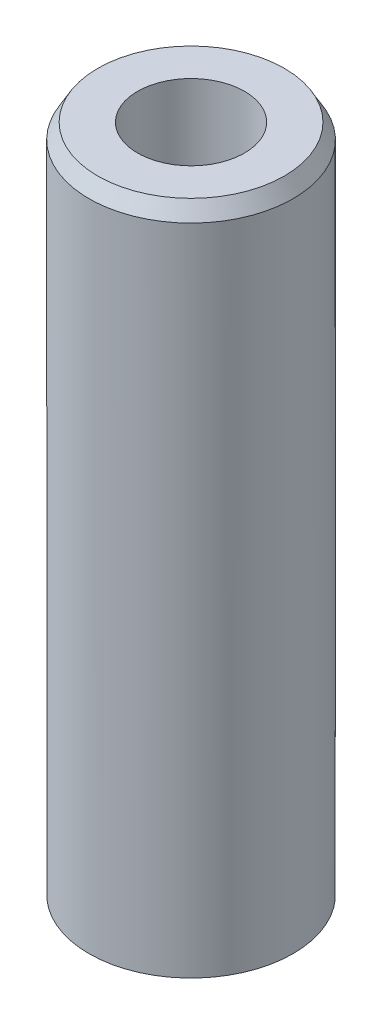
from build123d import *
from OCP.BRepFilletAPI import BRepFilletAPI_MakeChamfer

# Parameters (mm, degrees)
SKETCH1_R           = 30
BOSS_EXTRUDE1_DEPTH = 199.192233022
SKETCH2_R           = 15.721026193
CUT_EXTRUDE1_DEPTH  = 204.660368497
CHAMFER1_SIZE       = 4.473841582
CHAMFER1_SIZE2      = 2.582973642


with BuildPart() as part:
    # Sketch1 → Boss-Extrude1 (new body)
    with BuildSketch(Plane(origin=(0, 0, 0), x_dir=(1, 0, 0), z_dir=(0, 1, 0))):
        Circle(SKETCH1_R)
    extrude(amount=BOSS_EXTRUDE1_DEPTH)

    # Sketch2 → Cut-Extrude1 (cut, through all)
    with BuildSketch(Plane(origin=(0, 0, 0), x_dir=(1, 0, 0), z_dir=(0, 1, 0))):
        Circle(SKETCH2_R)
    extrude(amount=CUT_EXTRUDE1_DEPTH, mode=Mode.SUBTRACT)

    # Chamfer1: one chamfer whose edges measure the first distance from different faces: ONE call of the kernel's chamfer builder (chamfer() names one face for all edges)
    chamfer1_edges_1 = [part.edges().sort_by_distance(p)[0] for p in [
        (-30, 199.192233022, 0),
    ]]
    chamfer1_side_1 = [part.faces().sort_by_distance(p)[0] for p in [
        (-30, 99.596116511, 0),
    ]]
    chamfer1_edges_2 = [part.edges().sort_by_distance(p)[0] for p in [
        (-30, 0, 0),
    ]]
    chamfer1_side_2 = [part.faces().sort_by_distance(p)[0] for p in [
        (-29.151471863, 0, 0),
    ]]
    chamfer1 = BRepFilletAPI_MakeChamfer(part.part.solid().wrapped)
    for e in chamfer1_edges_1:
        chamfer1.Add(CHAMFER1_SIZE, CHAMFER1_SIZE2, e.wrapped, chamfer1_side_1[0].wrapped)  # the first distance lies on this face
    for e in chamfer1_edges_2:
        chamfer1.Add(CHAMFER1_SIZE, CHAMFER1_SIZE2, e.wrapped, chamfer1_side_2[0].wrapped)  # the first distance lies on this face
    add(Compound.cast(chamfer1.Shape()), mode=Mode.REPLACE)


solid = part.part
